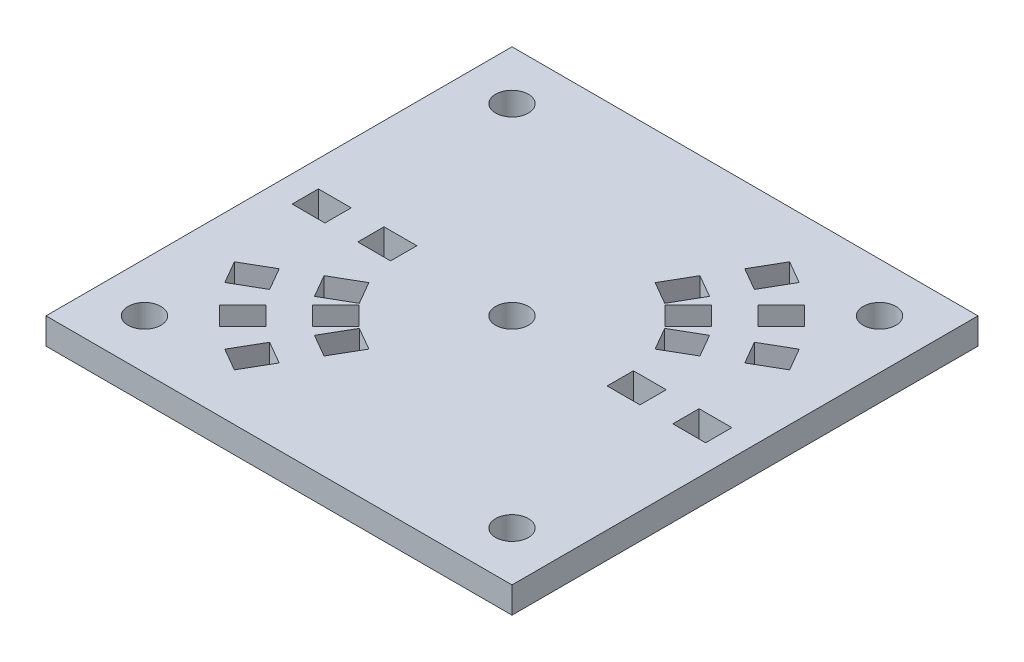
from build123d import *

# Parameters (mm, degrees)
SKETCH1_W           = 90.15984
SKETCH1_H           = 90.15984
SKETCH1_W_2         = 6.35
SKETCH1_H_2         = 5.08
BOSS_EXTRUDE1_DEPTH = 5.08
SKETCH2_R           = 3.175
CUT_EXTRUDE1_DEPTH  = 5.08


with BuildPart() as part:
    # Sketch1 → Boss-Extrude1 (new body)
    with BuildSketch(Plane(origin=(0, 0, 0), x_dir=(1, 0, 0), z_dir=(0, 1, 0))):
        with Locations((-1.415064753, -22.53996)):
            Rectangle(SKETCH1_W, SKETCH1_H)
        with Locations((-38.239984753, -22.53996)):
            Rectangle(SKETCH1_W_2, SKETCH1_H_2, mode=Mode.SUBTRACT)
        with Locations((-25.539984753, -22.53996)):
            Rectangle(SKETCH1_W_2, SKETCH1_H_2, mode=Mode.SUBTRACT)
        Polygon((20.784599772, 10.830986869), (17.609599772, 5.331725555), (13.210190721, 7.871725555), (16.385190721, 13.370986869), align=None, mode=Mode.SUBTRACT)
        Polygon((14.434599772, -0.167535759), (11.259599772, -5.666797073), (6.860190721, -3.126797073), (10.035190721, 2.372464241), align=None, mode=Mode.SUBTRACT)
        Polygon((28.66520115, 3.948203455), (24.175073089, -0.541924606), (20.582970641, 3.050177843), (25.073098701, 7.540305903), align=None, mode=Mode.SUBTRACT)
        Polygon((19.684945029, -5.032052666), (15.194816968, -9.522180727), (11.60271452, -5.930078278), (16.09284258, -1.439950218), align=None, mode=Mode.SUBTRACT)
        Polygon((34.495882116, -4.739704526), (28.996620802, -7.914704526), (26.456620802, -3.515295474), (31.955882116, -0.340295474), align=None, mode=Mode.SUBTRACT)
        Polygon((23.497359488, -11.089704526), (17.998098174, -14.264704526), (15.458098174, -9.865295474), (20.957359488, -6.690295474), align=None, mode=Mode.SUBTRACT)
        with Locations((35.409855247, -22.53996)):
            Rectangle(SKETCH1_W_2, SKETCH1_H_2, mode=Mode.SUBTRACT)
        with Locations((22.709855247, -22.53996)):
            Rectangle(SKETCH1_W_2, SKETCH1_H_2, mode=Mode.SUBTRACT)
        Polygon((-23.614729279, -55.910906869), (-20.439729279, -50.411645555), (-16.040320228, -52.951645555), (-19.215320228, -58.450906869), align=None, mode=Mode.SUBTRACT)
        Polygon((-17.264729279, -44.912384241), (-14.089729279, -39.413122927), (-9.690320228, -41.953122927), (-12.865320228, -47.452384241), align=None, mode=Mode.SUBTRACT)
        Polygon((-31.495330656, -49.028123455), (-27.005202596, -44.537995394), (-23.413100148, -48.130097843), (-27.903228208, -52.620225903), align=None, mode=Mode.SUBTRACT)
        Polygon((-22.515074535, -40.047867334), (-18.024946475, -35.557739273), (-14.432844026, -39.149841722), (-18.922972087, -43.639969782), align=None, mode=Mode.SUBTRACT)
        Polygon((-37.326011623, -40.340215474), (-31.826750309, -37.165215474), (-29.286750309, -41.564624526), (-34.786011623, -44.739624526), align=None, mode=Mode.SUBTRACT)
        Polygon((-26.327488995, -33.990215474), (-20.828227681, -30.815215474), (-18.288227681, -35.214624526), (-23.787488995, -38.389624526), align=None, mode=Mode.SUBTRACT)
    extrude(amount=BOSS_EXTRUDE1_DEPTH)

    # Sketch2 → Cut-Extrude1 (cut)
    with BuildSketch(Plane(origin=(0, 5.08, 0), x_dir=(1, 0, 0), z_dir=(0, 1, 0))):
        with Locations((-36.969984753, 13.01496)):
            Circle(SKETCH2_R)
        with Locations((-36.969984753, -58.09488)):
            Circle(SKETCH2_R)
        with Locations((34.139855247, -58.09488)):
            Circle(SKETCH2_R)
        with Locations((34.139855247, 13.01496)):
            Circle(SKETCH2_R)
        with Locations((-1.415064753, -22.53996)):
            Circle(SKETCH2_R)
    extrude(amount=-CUT_EXTRUDE1_DEPTH, mode=Mode.SUBTRACT)


solid = part.part
